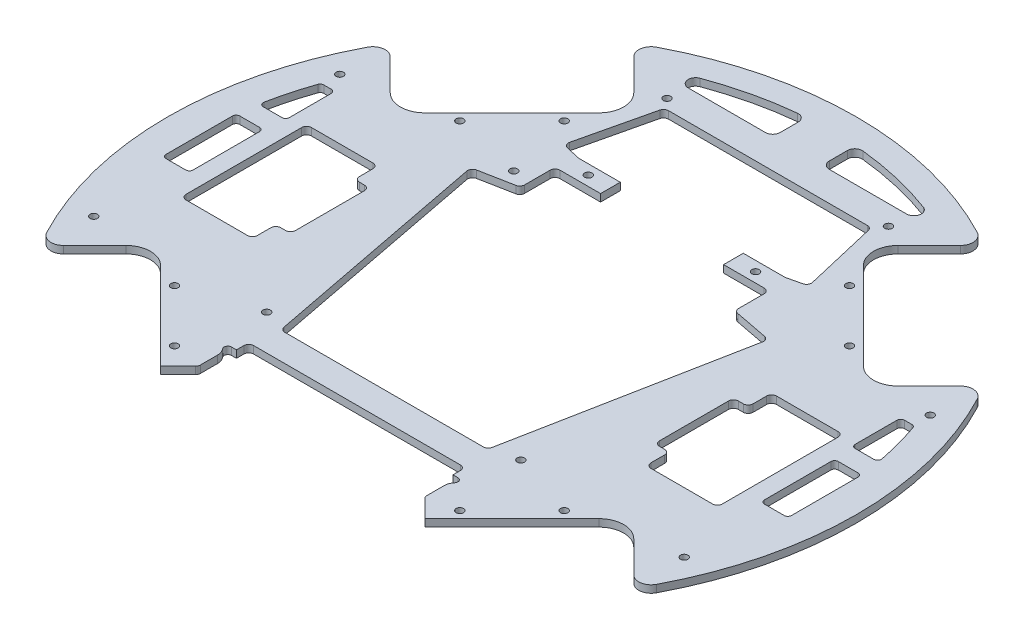
from build123d import *

# Parameters (mm, degrees)
SKETCH1_R                = 140
BOSS_EXTRUDE1_DEPTH      = 3
CUT_EXTRUDE4_REACH       = 200.013
CUT_EXTRUDE8_REACH       = 200.013
SKETCH12_R               = 1.5
FILLET2_R                = 5
FILLET2_OF_MIRROR1_R     = 5
MIRROR2_OUTLINE_R        = 1.5
MIRROR2_DEPTH            = 3
SKETCH17_W               = 280
SKETCH17_H               = 47
CUT_EXTRUDE11_DEPTH      = 199.01262586
CUT_EXTRUDE13_REACH      = 200.013
CUT_EXTRUDE16_REACH      = 200.013
SKETCH22_W               = 29
SKETCH22_H               = 51
FILLET4_R                = 2
CUT_EXTRUDE19_REACH      = 200.013
SKETCH25_R               = 1.5
CUT_EXTRUDE20_REACH      = 200.013
SKETCH26_R               = 1.5
CUT_EXTRUDE23_REACH      = 200.013
SKETCH28_W               = 6
SKETCH28_H               = 32
FILLET9_R                = 2
CUT_EXTRUDE25_DEPTH      = 199.01262586
CUT_EXTRUDE25_DEPTH_BACK = 199.01262586
FILLET7_R                = 2
CUT_EXTRUDE24_REACH      = 200.013
SKETCH29_W               = 11
SKETCH29_H               = 30
FILLET10_R               = 1.5
FILLET11_R               = 3
CUT_EXTRUDE28_REACH      = 200.013
SKETCH35_R               = 1.5
FILLET13_R               = 2
FILLET14_R               = 2


# Read off the part's stored shape, not the designer's step: Mirror2
with BuildPart() as part:
    # Sketch1 → Boss-Extrude1 (new body)
    with BuildSketch(Plane(origin=(0, 0, 0), x_dir=(1, 0, 0), z_dir=(0, 1, 0))):
        with Locations(Location((0, 0, 0), (0, 0, 270))):
            Circle(SKETCH1_R)
    extrude(amount=BOSS_EXTRUDE1_DEPTH)

    # Sketch7 → Cut-Extrude4 (cut, up to next)
    with BuildSketch(Plane(origin=(0, 3, 0), x_dir=(1, 0, 0), z_dir=(0, 1, 0)), mode=Mode.PRIVATE) as cut_extrude4_sk1:
        with BuildLine():
            Line((-89.130809769, -53.704760031), (-53.704760031, -89.130809769))
            ThreePointArc((-53.704760031, -89.130809769), (-50.790472504, -96.166522241), (-53.704760031, -103.202234714))
            Line((-53.704760031, -103.202234714), (-74.246212025, -123.743686708))
            Line((-74.246212025, -123.743686708), (-123.743686708, -74.246212025))
            Line((-123.743686708, -74.246212025), (-103.202234714, -53.704760031))
            ThreePointArc((-103.202234714, -53.704760031), (-96.166522241, -50.790472504), (-89.130809769, -53.704760031))
        make_face()
    cut_extrude4_tool1 = extrude(cut_extrude4_sk1.sketch, amount=-CUT_EXTRUDE4_REACH, mode=Mode.PRIVATE) & part.part
    cut_extrude4 = cut_extrude4_tool1.solids().sort_by_distance((-85.399531, 3, 85.399531))[0]
    add(cut_extrude4, mode=Mode.SUBTRACT)

    # Sketch12 → Cut-Extrude8 (cut, up to next)
    with BuildSketch(Plane.XZ, mode=Mode.PRIVATE) as cut_extrude8_sk1:
        with Locations(Location((-79.195959493, 57.982756057, 0), (0, 0, 270))):
            Circle(SKETCH12_R)
    cut_extrude8_tool1 = extrude(cut_extrude8_sk1.sketch, amount=-CUT_EXTRUDE8_REACH, mode=Mode.PRIVATE) & part.part
    # Sketch12 → Cut-Extrude8 (cut, up to next)
    with BuildSketch(Plane.XZ, mode=Mode.PRIVATE) as cut_extrude8_sk2:
        with Locations(Location((-57.982756057, 79.195959493, 0), (0, 0, 270))):
            Circle(SKETCH12_R)
    cut_extrude8_tool2 = extrude(cut_extrude8_sk2.sketch, amount=-CUT_EXTRUDE8_REACH, mode=Mode.PRIVATE) & part.part
    cut_extrude8_1 = cut_extrude8_tool1.solids().sort_by_distance((-79.195959, 0, 57.982756))[0]
    add(cut_extrude8_1, mode=Mode.SUBTRACT)
    cut_extrude8_2 = cut_extrude8_tool2.solids().sort_by_distance((-57.982756, 0, 79.195959))[0]
    add(cut_extrude8_2, mode=Mode.SUBTRACT)
    cut_extrude8 = cut_extrude8_1 + cut_extrude8_2  # Cut-Extrude8 as one shape, for the pattern or mirror that repeats it

    # Fillet2
    fillet2_edges = [part.edges().sort_by_distance(p)[0] for p in [
        (-120.600184905, 1.5, 71.102710222),
        (-71.102710222, 1.5, 120.600184905),
    ]]
    fillet(fillet2_edges, radius=FILLET2_R)

    # Mirror1: Cut-Extrude4, Cut-Extrude8 across plane
    add(cut_extrude4.mirror(Plane.XY), mode=Mode.SUBTRACT)
    add(cut_extrude8.mirror(Plane.XY), mode=Mode.SUBTRACT)

    # Fillet2 of Mirror1
    fillet2_of_mirror1_edges = [part.edges().sort_by_distance(p)[0] for p in [
        (-120.600184905, 1.5, -71.102710222),
        (-71.102710222, 1.5, -120.600184905),
    ]]
    fillet(fillet2_of_mirror1_edges, radius=FILLET2_OF_MIRROR1_R)

    # Mirror2 outline → Mirror2 (cut)
    with BuildSketch(Plane(origin=(0, 0, 0), x_dir=(1, 0, 0), z_dir=(0, 1, 0))):
        with BuildLine():
            ThreePointArc((65.217850337, 123.881524036), (67.832192841, 120.206382873), (66.424175303, 115.921649986))
            Line((66.424175303, 115.921649986), (53.704760031, 103.202234714))
            ThreePointArc((53.704760031, 103.202234714), (50.790472504, 96.166522241), (53.704760031, 89.130809769))
            Line((53.704760031, 89.130809769), (89.130809769, 53.704760031))
            ThreePointArc((89.130809769, 53.704760031), (96.166522241, 50.790472504), (103.202234714, 53.704760031))
            Line((103.202234714, 53.704760031), (115.921649986, 66.424175303))
            ThreePointArc((115.921649986, 66.424175303), (120.206382873, 67.832192841), (123.881524036, 65.217850337))
            ThreePointArc((123.881524036, 65.217850337), (98.994949366, 98.994949366), (65.217850337, 123.881524036))
        make_face()
        with BuildLine():
            ThreePointArc((65.217850337, -123.881524036), (98.994949366, -98.994949366), (123.881524036, -65.217850337))
            ThreePointArc((123.881524036, -65.217850337), (120.206382873, -67.832192841), (115.921649986, -66.424175303))
            Line((115.921649986, -66.424175303), (103.202234714, -53.704760031))
            ThreePointArc((103.202234714, -53.704760031), (96.166522241, -50.790472504), (89.130809769, -53.704760031))
            Line((89.130809769, -53.704760031), (53.704760031, -89.130809769))
            ThreePointArc((53.704760031, -89.130809769), (50.790472504, -96.166522241), (53.704760031, -103.202234714))
            Line((53.704760031, -103.202234714), (66.424175303, -115.921649986))
            ThreePointArc((66.424175303, -115.921649986), (67.832192841, -120.206382873), (65.217850337, -123.881524036))
        make_face()
        with Locations((79.195959493, -57.982756057)):
            Circle(MIRROR2_OUTLINE_R)
        with Locations((57.982756057, -79.195959493)):
            Circle(MIRROR2_OUTLINE_R)
        with Locations((79.195959493, 57.982756057)):
            Circle(MIRROR2_OUTLINE_R)
        with Locations((57.982756057, 79.195959493)):
            Circle(MIRROR2_OUTLINE_R)
    extrude(amount=MIRROR2_DEPTH, mode=Mode.SUBTRACT)

    # Sketch17 → Cut-Extrude11 (cut, through all)
    with BuildSketch(Plane.XZ):
        with Locations((0, 116.5)):
            Rectangle(SKETCH17_W, SKETCH17_H)
    extrude(amount=-CUT_EXTRUDE11_DEPTH, mode=Mode.SUBTRACT)

    # Sketch19 → Cut-Extrude13 (cut, up to next)
    with BuildSketch(Plane(origin=(0, 3, 0), x_dir=(1, 0, 0), z_dir=(0, 1, 0)), mode=Mode.PRIVATE) as cut_extrude13_sk1:
        with BuildLine():
            Line((-46, -68), (-44, -68))
            Line((-44, -68), (-44, -63))
            Line((-44, -63), (44, -63))
            Line((44, -63), (44, -68))
            Line((44, -68), (46, -68))
            ThreePointArc((46, -68), (47.357881604, -68.862695088), (47.153846154, -70.4584566))
            ThreePointArc((47.153846154, -70.4584566), (46.297300284, -71.95489638), (46, -73.653311931))
            Line((46, -73.653311931), (46, -93))
            Line((46, -93), (-46, -93))
            Line((-46, -93), (-46, -73.653311931))
            ThreePointArc((-46, -73.653311931), (-46.297300284, -71.95489638), (-47.153846154, -70.4584566))
            ThreePointArc((-47.153846154, -70.4584566), (-47.357881604, -68.862695088), (-46, -68))
        make_face()
    cut_extrude13_tool1 = extrude(cut_extrude13_sk1.sketch, amount=-CUT_EXTRUDE13_REACH, mode=Mode.PRIVATE) & part.part
    add(cut_extrude13_tool1.solids().sort_by_distance((0, 3, 78.065675))[0], mode=Mode.SUBTRACT)

    # Sketch22 → Cut-Extrude16 (cut, up to next)
    with BuildSketch(Plane(origin=(0, 3, 0), x_dir=(1, 0, 0), z_dir=(0, 1, 0)), mode=Mode.PRIVATE) as cut_extrude16_sk1:
        with Locations((94.5, 0)):
            Rectangle(SKETCH22_W, SKETCH22_H)
    cut_extrude16_tool1 = extrude(cut_extrude16_sk1.sketch, amount=-CUT_EXTRUDE16_REACH, mode=Mode.PRIVATE) & part.part
    # Sketch22 → Cut-Extrude16 (cut, up to next)
    with BuildSketch(Plane(origin=(0, 3, 0), x_dir=(1, 0, 0), z_dir=(0, 1, 0)), mode=Mode.PRIVATE) as cut_extrude16_sk2:
        with Locations((-94.5, 0)):
            Rectangle(SKETCH22_W, SKETCH22_H)
    cut_extrude16_tool2 = extrude(cut_extrude16_sk2.sketch, amount=-CUT_EXTRUDE16_REACH, mode=Mode.PRIVATE) & part.part
    add(cut_extrude16_tool1.solids().sort_by_distance((94.5, 3, 0))[0], mode=Mode.SUBTRACT)
    add(cut_extrude16_tool2.solids().sort_by_distance((-94.5, 3, 0))[0], mode=Mode.SUBTRACT)

    # Fillet4
    fillet4_edges = [part.edges().sort_by_distance(p)[0] for p in [
        (80, 1.5, 25.5),
        (80, 1.5, -25.5),
        (109, 1.5, -25.5),
        (109, 1.5, 25.5),
        (-109, 1.5, 25.5),
        (-109, 1.5, -25.5),
        (-80, 1.5, -25.5),
        (-80, 1.5, 25.5),
    ]]
    fillet(fillet4_edges, radius=FILLET4_R)

    # Sketch25 → Cut-Extrude19 (cut, up to next)
    with BuildSketch(Plane(origin=(0, 3, 0), x_dir=(1, 0, 0), z_dir=(0, 1, 0)), mode=Mode.PRIVATE) as cut_extrude19_sk1:
        with Locations(Location((-120, 50, 0), (0, 0, 270))):
            Circle(SKETCH25_R)
    cut_extrude19_tool1 = extrude(cut_extrude19_sk1.sketch, amount=-CUT_EXTRUDE19_REACH, mode=Mode.PRIVATE) & part.part
    # Sketch25 → Cut-Extrude19 (cut, up to next)
    with BuildSketch(Plane(origin=(0, 3, 0), x_dir=(1, 0, 0), z_dir=(0, 1, 0)), mode=Mode.PRIVATE) as cut_extrude19_sk2:
        with Locations(Location((-120, -50, 0), (0, 0, 270))):
            Circle(SKETCH25_R)
    cut_extrude19_tool2 = extrude(cut_extrude19_sk2.sketch, amount=-CUT_EXTRUDE19_REACH, mode=Mode.PRIVATE) & part.part
    # Sketch25 → Cut-Extrude19 (cut, up to next)
    with BuildSketch(Plane(origin=(0, 3, 0), x_dir=(1, 0, 0), z_dir=(0, 1, 0)), mode=Mode.PRIVATE) as cut_extrude19_sk3:
        with Locations(Location((120, -50, 0), (0, 0, 270))):
            Circle(SKETCH25_R)
    cut_extrude19_tool3 = extrude(cut_extrude19_sk3.sketch, amount=-CUT_EXTRUDE19_REACH, mode=Mode.PRIVATE) & part.part
    # Sketch25 → Cut-Extrude19 (cut, up to next)
    with BuildSketch(Plane(origin=(0, 3, 0), x_dir=(1, 0, 0), z_dir=(0, 1, 0)), mode=Mode.PRIVATE) as cut_extrude19_sk4:
        with Locations(Location((120, 50, 0), (0, 0, 270))):
            Circle(SKETCH25_R)
    cut_extrude19_tool4 = extrude(cut_extrude19_sk4.sketch, amount=-CUT_EXTRUDE19_REACH, mode=Mode.PRIVATE) & part.part
    add(cut_extrude19_tool1.solids().sort_by_distance((-120, 3, -50))[0], mode=Mode.SUBTRACT)
    add(cut_extrude19_tool2.solids().sort_by_distance((-120, 3, 50))[0], mode=Mode.SUBTRACT)
    add(cut_extrude19_tool3.solids().sort_by_distance((120, 3, 50))[0], mode=Mode.SUBTRACT)
    add(cut_extrude19_tool4.solids().sort_by_distance((120, 3, -50))[0], mode=Mode.SUBTRACT)

    # Sketch26 → Cut-Extrude20 (cut, up to next)
    with BuildSketch(Plane(origin=(0, 3, 0), x_dir=(1, 0, 0), z_dir=(0, 1, 0)), mode=Mode.PRIVATE) as cut_extrude20_sk1:
        with Locations(Location((-34, 65, 0), (0, 0, 270))):
            Circle(SKETCH26_R)
    cut_extrude20_tool1 = extrude(cut_extrude20_sk1.sketch, amount=-CUT_EXTRUDE20_REACH, mode=Mode.PRIVATE) & part.part
    # Sketch26 → Cut-Extrude20 (cut, up to next)
    with BuildSketch(Plane(origin=(0, 3, 0), x_dir=(1, 0, 0), z_dir=(0, 1, 0)), mode=Mode.PRIVATE) as cut_extrude20_sk2:
        with Locations(Location((34, 65, 0), (0, 0, 270))):
            Circle(SKETCH26_R)
    cut_extrude20_tool2 = extrude(cut_extrude20_sk2.sketch, amount=-CUT_EXTRUDE20_REACH, mode=Mode.PRIVATE) & part.part
    # Sketch26 → Cut-Extrude20 (cut, up to next)
    with BuildSketch(Plane(origin=(0, 3, 0), x_dir=(1, 0, 0), z_dir=(0, 1, 0)), mode=Mode.PRIVATE) as cut_extrude20_sk3:
        with Locations(Location((-45, 108, 0), (0, 0, 270))):
            Circle(SKETCH26_R)
    cut_extrude20_tool3 = extrude(cut_extrude20_sk3.sketch, amount=-CUT_EXTRUDE20_REACH, mode=Mode.PRIVATE) & part.part
    # Sketch26 → Cut-Extrude20 (cut, up to next)
    with BuildSketch(Plane(origin=(0, 3, 0), x_dir=(1, 0, 0), z_dir=(0, 1, 0)), mode=Mode.PRIVATE) as cut_extrude20_sk4:
        with Locations(Location((45, 108, 0), (0, 0, 270))):
            Circle(SKETCH26_R)
    cut_extrude20_tool4 = extrude(cut_extrude20_sk4.sketch, amount=-CUT_EXTRUDE20_REACH, mode=Mode.PRIVATE) & part.part
    # Sketch26 → Cut-Extrude20 (cut, up to next)
    with BuildSketch(Plane(origin=(0, 3, 0), x_dir=(1, 0, 0), z_dir=(0, 1, 0)), mode=Mode.PRIVATE) as cut_extrude20_sk5:
        with BuildLine():
            Line((-58.685603004, 116), (-10, 116))
            Line((-10, 116), (-10, 129.614813968))
            ThreePointArc((-10, 129.614813968), (-35.010981204, 125.196769907), (-58.685603004, 116))
        make_face()
    cut_extrude20_tool5 = extrude(cut_extrude20_sk5.sketch, amount=-CUT_EXTRUDE20_REACH, mode=Mode.PRIVATE) & part.part
    # Sketch26 → Cut-Extrude20 (cut, up to next)
    with BuildSketch(Plane(origin=(0, 3, 0), x_dir=(1, 0, 0), z_dir=(0, 1, 0)), mode=Mode.PRIVATE) as cut_extrude20_sk6:
        with BuildLine():
            Line((10, 129.614813968), (10, 116))
            Line((10, 116), (58.685603004, 116))
            ThreePointArc((58.685603004, 116), (35.010981204, 125.196769907), (10, 129.614813968))
        make_face()
    cut_extrude20_tool6 = extrude(cut_extrude20_sk6.sketch, amount=-CUT_EXTRUDE20_REACH, mode=Mode.PRIVATE) & part.part
    add(cut_extrude20_tool1.solids().sort_by_distance((-34, 3, -65))[0], mode=Mode.SUBTRACT)
    add(cut_extrude20_tool2.solids().sort_by_distance((34, 3, -65))[0], mode=Mode.SUBTRACT)
    add(cut_extrude20_tool3.solids().sort_by_distance((-45, 3, -108))[0], mode=Mode.SUBTRACT)
    add(cut_extrude20_tool4.solids().sort_by_distance((45, 3, -108))[0], mode=Mode.SUBTRACT)
    add(cut_extrude20_tool5.solids().sort_by_distance((-27.919771, 3, -121.189133))[0], mode=Mode.SUBTRACT)
    add(cut_extrude20_tool6.solids().sort_by_distance((27.919771, 3, -121.189133))[0], mode=Mode.SUBTRACT)

    # Sketch28 → Cut-Extrude23 (cut, up to next)
    with BuildSketch(Plane(origin=(0, 3, 0), x_dir=(1, 0, 0), z_dir=(0, 1, 0)), mode=Mode.PRIVATE) as cut_extrude23_sk1:
        with Locations((-77, 0)):
            Rectangle(SKETCH28_W, SKETCH28_H)
    cut_extrude23_tool1 = extrude(cut_extrude23_sk1.sketch, amount=-CUT_EXTRUDE23_REACH, mode=Mode.PRIVATE) & part.part
    # Sketch28 → Cut-Extrude23 (cut, up to next)
    with BuildSketch(Plane(origin=(0, 3, 0), x_dir=(1, 0, 0), z_dir=(0, 1, 0)), mode=Mode.PRIVATE) as cut_extrude23_sk2:
        with Locations((77, 0)):
            Rectangle(SKETCH28_W, SKETCH28_H)
    cut_extrude23_tool2 = extrude(cut_extrude23_sk2.sketch, amount=-CUT_EXTRUDE23_REACH, mode=Mode.PRIVATE) & part.part
    add(cut_extrude23_tool1.solids().sort_by_distance((-77, 3, 0))[0], mode=Mode.SUBTRACT)
    add(cut_extrude23_tool2.solids().sort_by_distance((77, 3, 0))[0], mode=Mode.SUBTRACT)

    # Fillet9
    fillet9_edges = [part.edges().sort_by_distance(p)[0] for p in [
        (-80, 1.5, 16),
        (-80, 1.5, -16),
        (-74, 1.5, -16),
        (-74, 1.5, 16),
        (80, 1.5, -16),
        (80, 1.5, 16),
        (74, 1.5, 16),
        (74, 1.5, -16),
    ]]
    fillet(fillet9_edges, radius=FILLET9_R)

    # Sketch30 → Cut-Extrude25 (cut, two sides: drawn at the far end of the back side and taken through both)
    with BuildSketch(Plane(origin=(0, 3, 0), x_dir=(1, 0, 0), z_dir=(0, 1, 0)).offset(-CUT_EXTRUDE25_DEPTH_BACK)):
        with BuildLine():
            ThreePointArc((51.307782702, -93), (52.282060914, -90.926505699), (53.704760031, -89.130809769))
            Line((53.704760031, -89.130809769), (46, -81.426049737))
            Line((46, -81.426049737), (46, -93))
            Line((46, -93), (51.307782702, -93))
        make_face()
        with BuildLine():
            Line((-46, -93), (-46, -81.426049737))
            Line((-46, -81.426049737), (-53.704760031, -89.130809769))
            ThreePointArc((-53.704760031, -89.130809769), (-52.282060914, -90.926505698), (-51.307782702, -93))
            Line((-51.307782702, -93), (-46, -93))
        make_face()
    extrude(amount=CUT_EXTRUDE25_DEPTH + CUT_EXTRUDE25_DEPTH_BACK, mode=Mode.SUBTRACT)

    # Fillet7
    fillet7_edges = [part.edges().sort_by_distance(p)[0] for p in [
        (46, 1.5, 81.426049737),
        (-46, 1.5, 81.426049737),
    ]]
    fillet(fillet7_edges, radius=FILLET7_R)

    # Sketch29 → Cut-Extrude24 (cut, up to next)
    with BuildSketch(Plane(origin=(0, 3, 0), x_dir=(1, 0, 0), z_dir=(0, 1, 0)), mode=Mode.PRIVATE) as cut_extrude24_sk1:
        with BuildLine():
            Line((115, 23), (125.916639091, 23))
            ThreePointArc((125.916639091, 23), (123.643963805, 33.108461376), (120.561187784, 43))
            Line((120.561187784, 43), (115, 43))
            Line((115, 43), (115, 23))
        make_face()
    cut_extrude24_tool1 = extrude(cut_extrude24_sk1.sketch, amount=-CUT_EXTRUDE24_REACH, mode=Mode.PRIVATE) & part.part
    # Sketch29 → Cut-Extrude24 (cut, up to next)
    with BuildSketch(Plane(origin=(0, 3, 0), x_dir=(1, 0, 0), z_dir=(0, 1, 0)), mode=Mode.PRIVATE) as cut_extrude24_sk2:
        with BuildLine():
            Line((-120.561187784, 43), (-115, 43))
            Line((-115, 43), (-115, 23))
            Line((-115, 23), (-125.916639091, 23))
            ThreePointArc((-125.916639091, 23), (-123.643963805, 33.108461376), (-120.561187784, 43))
        make_face()
    cut_extrude24_tool2 = extrude(cut_extrude24_sk2.sketch, amount=-CUT_EXTRUDE24_REACH, mode=Mode.PRIVATE) & part.part
    # Sketch29 → Cut-Extrude24 (cut, up to next)
    with BuildSketch(Plane(origin=(0, 3, 0), x_dir=(1, 0, 0), z_dir=(0, 1, 0)), mode=Mode.PRIVATE) as cut_extrude24_sk3:
        with Locations((-121.618055366, 0)):
            Rectangle(SKETCH29_W, SKETCH29_H)
    cut_extrude24_tool3 = extrude(cut_extrude24_sk3.sketch, amount=-CUT_EXTRUDE24_REACH, mode=Mode.PRIVATE) & part.part
    # Sketch29 → Cut-Extrude24 (cut, up to next)
    with BuildSketch(Plane(origin=(0, 3, 0), x_dir=(1, 0, 0), z_dir=(0, 1, 0)), mode=Mode.PRIVATE) as cut_extrude24_sk4:
        with Locations((121.618055366, 0)):
            Rectangle(SKETCH29_W, SKETCH29_H)
    cut_extrude24_tool4 = extrude(cut_extrude24_sk4.sketch, amount=-CUT_EXTRUDE24_REACH, mode=Mode.PRIVATE) & part.part
    add(cut_extrude24_tool1.solids().sort_by_distance((119.404913, 3, -31.954882))[0], mode=Mode.SUBTRACT)
    add(cut_extrude24_tool2.solids().sort_by_distance((-119.404913, 3, -31.954882))[0], mode=Mode.SUBTRACT)
    add(cut_extrude24_tool3.solids().sort_by_distance((-121.618055, 3, 0))[0], mode=Mode.SUBTRACT)
    add(cut_extrude24_tool4.solids().sort_by_distance((121.618055, 3, 0))[0], mode=Mode.SUBTRACT)

    # Fillet10
    fillet10_edges = [part.edges().sort_by_distance(p)[0] for p in [
        (115, 1.5, -23),
        (115, 1.5, -43),
        (120.561187784, 1.5, -43),
        (125.916639091, 1.5, -23),
        (-115, 1.5, -43),
        (-115, 1.5, -23),
        (-125.916639091, 1.5, -23),
        (-120.561187784, 1.5, -43),
        (-127.118055366, 1.5, 15),
        (-127.118055366, 1.5, -15),
        (-116.118055366, 1.5, -15),
        (-116.118055366, 1.5, 15),
        (127.118055366, 1.5, -15),
        (127.118055366, 1.5, 15),
        (116.118055366, 1.5, 15),
        (116.118055366, 1.5, -15),
    ]]
    fillet(fillet10_edges, radius=FILLET10_R)

    # Fillet11
    fillet11_edges = [part.edges().sort_by_distance(p)[0] for p in [
        (-58.685603004, 1.5, -116),
        (-10, 1.5, -129.614813968),
        (-10, 1.5, -116),
        (10, 1.5, -129.614813968),
        (58.685603004, 1.5, -116),
        (10, 1.5, -116),
    ]]
    fillet(fillet11_edges, radius=FILLET11_R)

    # Sketch35 → Cut-Extrude28 (cut, up to next)
    with BuildSketch(Plane(origin=(0, 3, 0), x_dir=(1, 0, 0), z_dir=(0, 1, 0)), mode=Mode.PRIVATE) as cut_extrude28_sk1:
        with Locations(Location((-50.6, 51.3, 0), (0, 0, 270))):
            Circle(SKETCH35_R)
    cut_extrude28_tool1 = extrude(cut_extrude28_sk1.sketch, amount=-CUT_EXTRUDE28_REACH, mode=Mode.PRIVATE) & part.part
    # Sketch35 → Cut-Extrude28 (cut, up to next)
    with BuildSketch(Plane(origin=(0, 3, 0), x_dir=(1, 0, 0), z_dir=(0, 1, 0)), mode=Mode.PRIVATE) as cut_extrude28_sk2:
        with Locations(Location((-51.1, -48.6, 0), (0, 0, 270))):
            Circle(SKETCH35_R)
    cut_extrude28_tool2 = extrude(cut_extrude28_sk2.sketch, amount=-CUT_EXTRUDE28_REACH, mode=Mode.PRIVATE) & part.part
    # Sketch35 → Cut-Extrude28 (cut, up to next)
    with BuildSketch(Plane(origin=(0, 3, 0), x_dir=(1, 0, 0), z_dir=(0, 1, 0)), mode=Mode.PRIVATE) as cut_extrude28_sk3:
        with Locations(Location((52.6, -49, 0), (0, 0, 270))):
            Circle(SKETCH35_R)
    cut_extrude28_tool3 = extrude(cut_extrude28_sk3.sketch, amount=-CUT_EXTRUDE28_REACH, mode=Mode.PRIVATE) & part.part
    # Sketch35 → Cut-Extrude28 (cut, up to next)
    with BuildSketch(Plane(origin=(0, 3, 0), x_dir=(1, 0, 0), z_dir=(0, 1, 0)), mode=Mode.PRIVATE) as cut_extrude28_sk4:
        Polygon((-42, -52), (-60.5, 43.714175551), (-43.5, 47), (-43.5, 61), (-25, 61), (-25, 69), (-42.002480208, 69), (-49.790567771, 70.829123317), (-42, 104), (42, 104), (49.790567771, 70.829123317), (42.002480208, 69), (25, 69), (25, 61), (43.5, 61), (43.5, 47), (60.5, 43.714175551), (42, -52), align=None)
    cut_extrude28_tool4 = extrude(cut_extrude28_sk4.sketch, amount=-CUT_EXTRUDE28_REACH, mode=Mode.PRIVATE) & part.part
    add(cut_extrude28_tool1.solids().sort_by_distance((-50.6, 3, -51.3))[0], mode=Mode.SUBTRACT)
    add(cut_extrude28_tool2.solids().sort_by_distance((-51.1, 3, 48.6))[0], mode=Mode.SUBTRACT)
    add(cut_extrude28_tool3.solids().sort_by_distance((52.6, 3, 49))[0], mode=Mode.SUBTRACT)
    add(cut_extrude28_tool4.solids().sort_by_distance((0, 3, -24.782262))[0], mode=Mode.SUBTRACT)

    # Fillet13
    fillet13_edges = [part.edges().sort_by_distance(p)[0] for p in [
        (-42.002480208, 1.5, -69),
        (-49.790567771, 1.5, -70.829123317),
        (-42, 1.5, -104),
        (42, 1.5, -104),
        (49.790567771, 1.5, -70.829123317),
        (42.002480208, 1.5, -69),
        (43.5, 1.5, -61),
        (43.5, 1.5, -47),
        (60.5, 1.5, -43.714175551),
        (42, 1.5, 52),
        (-42, 1.5, 52),
        (-60.5, 1.5, -43.714175551),
        (-43.5, 1.5, -47),
        (-43.5, 1.5, -61),
    ]]
    fillet(fillet13_edges, radius=FILLET13_R)

    # Fillet14
    fillet14_edges = [part.edges().sort_by_distance(p)[0] for p in [
        (-44, 1.5, 63),
        (44, 1.5, 63),
    ]]
    fillet(fillet14_edges, radius=FILLET14_R)


solid = part.part
